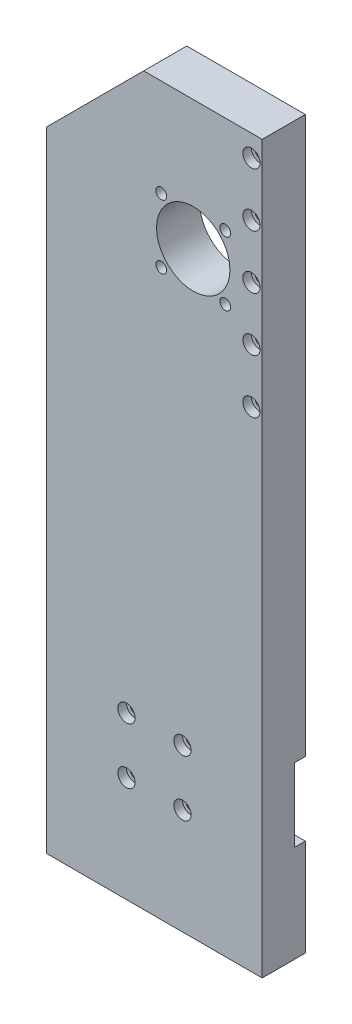
from build123d import *

# Parameters (mm, degrees)
SKETCH1_W                      = 100
SKETCH1_H                      = 337
SKETCH1_R                      = 17
SKETCH1_R_2                    = 2.5
SKETCH1_R_3                    = 2
BOSS_EXTRUDE1_DEPTH            = 20
CHAMFER1_SIZE                  = 45
SKETCH2_W                      = 100
SKETCH2_H                      = 34
CUT_EXTRUDE1_DEPTH             = 5
CBORE_FOR_M4_SHCS1_D           = 4.5
CBORE_FOR_M4_SHCS1_CBORE_D     = 8
CBORE_FOR_M4_SHCS1_CBORE_DEPTH = 4
CBORE_FOR_M4_SHCS2_D           = 4.5
CBORE_FOR_M4_SHCS2_CBORE_D     = 8
CBORE_FOR_M4_SHCS2_CBORE_DEPTH = 4
M4_TAPPED_HOLE1_D              = 3.3
M4_TAPPED_HOLE1_DEPTH          = 16.1
M4_TAPPED_HOLE1_TIP            = 0.991420021


with BuildPart() as part:
    # Sketch1 → Boss-Extrude1 (new body)
    with BuildSketch(Plane.XY):
        with Locations((47.704546062, 452.000370419)):
            Rectangle(SKETCH1_W, SKETCH1_H)
        with Locations((65.704546062, 560.500370419)):
            Circle(SKETCH1_R, mode=Mode.SUBTRACT)
        with Locations((80.553788467, 575.349612824)):
            Circle(SKETCH1_R_2, mode=Mode.SUBTRACT)
        with Locations((80.553788467, 545.651128014)):
            Circle(SKETCH1_R_2, mode=Mode.SUBTRACT)
        with Locations((50.855303657, 545.651128014)):
            Circle(SKETCH1_R_2, mode=Mode.SUBTRACT)
        with Locations((50.855303657, 575.349612824)):
            Circle(SKETCH1_R_2, mode=Mode.SUBTRACT)
        with Locations((34.704546062, 358.500370419)):
            Circle(SKETCH1_R_3, mode=Mode.SUBTRACT)
        with Locations((60.704546062, 358.500370419)):
            Circle(SKETCH1_R_3, mode=Mode.SUBTRACT)
        with Locations((34.704546062, 332.500370419)):
            Circle(SKETCH1_R_3, mode=Mode.SUBTRACT)
        with Locations((60.704546062, 332.500370419)):
            Circle(SKETCH1_R_3, mode=Mode.SUBTRACT)
    extrude(amount=BOSS_EXTRUDE1_DEPTH)

    # Chamfer1
    chamfer1_edges = [part.edges().sort_by_distance(p)[0] for p in [
        (-2.295453938, 620.500370419, 10),
    ]]
    chamfer(chamfer1_edges, length=CHAMFER1_SIZE)

    # Sketch2 → Cut-Extrude1 (cut)
    with BuildSketch(Plane.XY):
        with Locations((47.704546062, 345.500370419)):
            Rectangle(SKETCH2_W, SKETCH2_H)
    extrude(amount=CUT_EXTRUDE1_DEPTH, mode=Mode.SUBTRACT)

    # CBORE for M4 SHCS1 (through all)
    with Locations(Plane.XY.offset(20)):
        with Locations((92.704546062, 610.500370419), (92.704546062, 585.500370419), (92.704546062, 560.500370419), (92.704546062, 535.500370419), (92.704546062, 510.500370419)):
            CounterBoreHole(CBORE_FOR_M4_SHCS1_D / 2, CBORE_FOR_M4_SHCS1_CBORE_D / 2, CBORE_FOR_M4_SHCS1_CBORE_DEPTH)

    # CBORE for M4 SHCS2 (through all)
    with Locations(Plane(origin=(34.704546062, 358.500370419, 20), x_dir=(1, 0, 0), z_dir=(0, 0, 1))):
        with Locations((0, 0), (26, 0), (0, -26), (26, -26)):
            CounterBoreHole(CBORE_FOR_M4_SHCS2_D / 2, CBORE_FOR_M4_SHCS2_CBORE_D / 2, CBORE_FOR_M4_SHCS2_CBORE_DEPTH)

    # M4 Tapped Hole1
    with Locations(Plane(origin=(7.704546062, 283.500370419, 10), x_dir=(0, 0, -1), z_dir=(0, -1, 0))):
        with Locations((0, 0), (0, 20), (0, 60), (0, 80)):
            Hole(M4_TAPPED_HOLE1_D / 2, depth=M4_TAPPED_HOLE1_DEPTH)
            with Locations((0, 0, -(M4_TAPPED_HOLE1_DEPTH + M4_TAPPED_HOLE1_TIP / 2))):  # 118° drill point
                Cone(0, M4_TAPPED_HOLE1_D / 2, M4_TAPPED_HOLE1_TIP, mode=Mode.SUBTRACT)


solid = part.part
